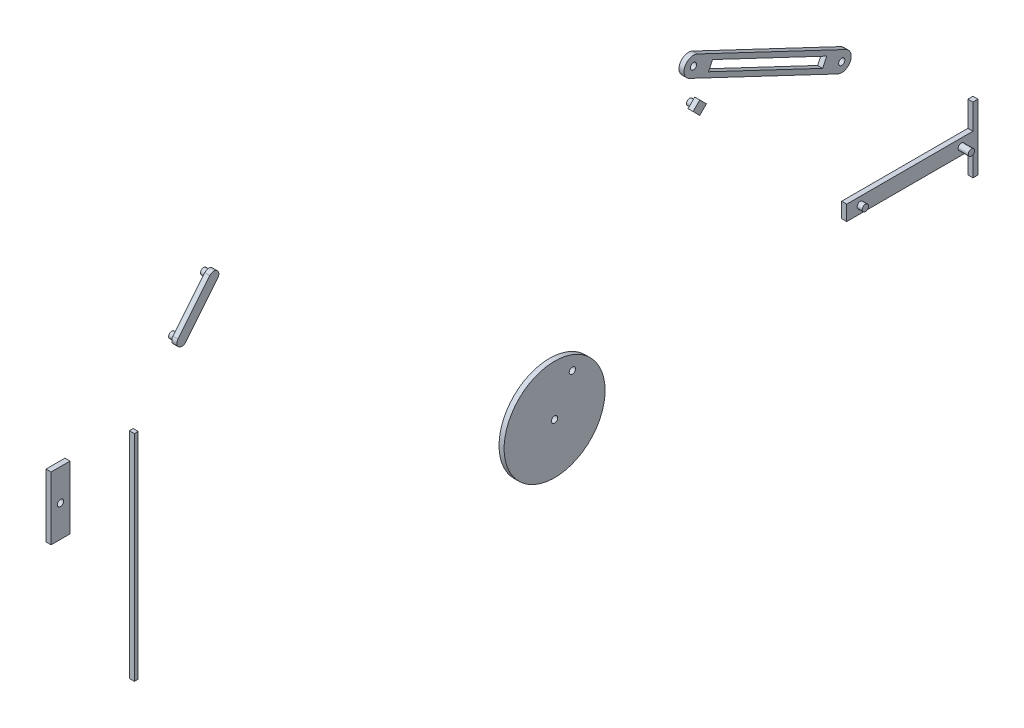
from build123d import *

# Parameters (mm, degrees)
SKETCH5_R            = 400
BOSS_EXTRUDE6_DEPTH  = 40
SKETCH6_R            = 25
CUT_EXTRUDE2_DEPTH   = 40
SKETCH8_R            = 25
BOSS_EXTRUDE7_DEPTH  = 40
BOSS_EXTRUDE8_START  = -40
SKETCH8_3_R          = 25
BOSS_EXTRUDE8_DEPTH  = 80
SKETCH9_R            = 25
CUT_EXTRUDE3_DEPTH   = 40
SKETCH9_4_R          = 25
BOSS_EXTRUDE9_DEPTH  = 40
BOSS_EXTRUDE10_START = 40
SKETCH9_5_R          = 25
BOSS_EXTRUDE10_DEPTH = 80
SKETCH10_R           = 25
BOSS_EXTRUDE11_DEPTH = 80
SKETCH12_R           = 25
BOSS_EXTRUDE12_DEPTH = 40
BOSS_EXTRUDE13_DEPTH = 40
SKETCH13_3_R         = 25
BOSS_EXTRUDE14_DEPTH = 40
SKETCH14_W           = 20
SKETCH14_H           = 2000
SKETCH14_W_2         = 150
SKETCH14_H_2         = 500
SKETCH14_R           = 25
BOSS_EXTRUDE15_DEPTH = 40
CUT_EXTRUDE4_DEPTH   = 369
BOSS_EXTRUDE16_DEPTH = 30
SCALE1_START         = -40
SCALE1_OUTLINE_R     = 60
SCALE1_OUTLINE_W     = 255
SCALE1_OUTLINE_H     = 4.5
SCALE1_OUTLINE_W_2   = 75
SCALE1_OUTLINE_H_2   = 22.5
SCALE1_OUTLINE_R_2   = 3.75
SCALE1_DEPTH         = 160
SCALE1_2_OUTLINE_R   = 60
SCALE1_2_OUTLINE_R_2 = 3.75
SCALE1_2_DEPTH       = 57
SCALE1_START_2       = 23
SCALE1_3_OUTLINE_R   = 60
SCALE1_3_OUTLINE_R_2 = 3.75
SCALE1_3_OUTLINE_W   = 255
SCALE1_3_OUTLINE_H   = 4.5
SCALE1_3_OUTLINE_W_2 = 75
SCALE1_3_OUTLINE_H_2 = 22.5
SCALE1_3_DEPTH       = 34
SCALE1_START_3       = 63
SCALE1_4_OUTLINE_W   = 255
SCALE1_4_OUTLINE_H   = 4.5
SCALE1_4_OUTLINE_W_2 = 75
SCALE1_4_OUTLINE_H_2 = 22.5
SCALE1_4_OUTLINE_R   = 3.75
SCALE1_4_DEPTH       = 57
SCALE1_START_4       = -15.179599902
SCALE1_5_OUTLINE_R   = 3.75
SCALE1_5_DEPTH       = 57.382224362
SCALE1_6_DEPTH       = 18.820400098
SCALE1_START_5       = 99.739776566
SCALE1_7_DEPTH       = 20.260223434
SCALE1_START_6       = 54.20262446
SCALE1_8_OUTLINE_R   = 3.75
SCALE1_8_DEPTH       = 39.537152106
SCALE1_START_7       = -9.179599902
SCALE1_9_OUTLINE_R   = 3.75
SCALE1_9_DEPTH       = 96.919376468
SCALE1_START_8       = -3.179599902
SCALE1_10_OUTLINE_R  = 3.75
SCALE1_10_DEPTH      = 51.382224362
SCALE1_START_9       = 57
SCALE1_11_OUTLINE_R  = 3.75
SCALE1_11_DEPTH      = 6


# Read off the part's stored shape, not the designer's step: Scale1
with BuildPart() as part:
    # Sketch5 → Boss-Extrude6 (new body)
    with BuildSketch(Plane(origin=(0, 0, 0), x_dir=(0, 0, -1), z_dir=(1, 0, 0))):
        Circle(SKETCH5_R)
    extrude(amount=BOSS_EXTRUDE6_DEPTH)

    # Sketch6 → Cut-Extrude2 (cut)
    with BuildSketch(Plane(origin=(40, 0, 0), x_dir=(0, 0, -1), z_dir=(1, 0, 0))):
        Circle(SKETCH6_R)
    extrude(amount=-CUT_EXTRUDE2_DEPTH, mode=Mode.SUBTRACT)

    # Sketch9 → Cut-Extrude3 (cut)
    with BuildSketch(Plane(origin=(40, 0, 0), x_dir=(0, 0, -1), z_dir=(1, 0, 0))):
        with Locations((140.808826922, 264.901631291)):
            Circle(SKETCH9_R)
    extrude(amount=-CUT_EXTRUDE3_DEPTH, mode=Mode.SUBTRACT)


with BuildPart() as body_2:
    # Sketch8 → Boss-Extrude7 (new body)
    with BuildSketch(Plane(origin=(0, 0, 0), x_dir=(0, 0, -1), z_dir=(1, 0, 0))):
        Polygon((-107.7, 60), (892.3, 60), (892.3, 260), (932.3, 260), (932.3, -260), (892.3, -260), (892.3, -60), (-107.7, -60), align=None)
        Circle(SKETCH8_R, mode=Mode.SUBTRACT)
    extrude(amount=-BOSS_EXTRUDE7_DEPTH)


with BuildPart() as body_3:
    # Sketch8<3> → Boss-Extrude8 (new body)
    with BuildSketch(Plane(origin=(0, 0, 0), x_dir=(0, 0, -1), z_dir=(1, 0, 0)).offset(BOSS_EXTRUDE8_START)):
        Circle(SKETCH8_3_R)
    extrude(amount=BOSS_EXTRUDE8_DEPTH)

    # Combine2: union body 2
    add(body_2.part)

    # Sketch10 → Boss-Extrude11 (add)
    with BuildSketch(Plane(origin=(0, 0, 0), x_dir=(0, 0, -1), z_dir=(1, 0, 0))):
        with Locations(Location((800, 0, 0), (0, 0, 180))):
            Circle(SKETCH10_R)
    extrude(amount=BOSS_EXTRUDE11_DEPTH)


with BuildPart() as body_3_2:
    # Sketch9<4> → Boss-Extrude9 (new body)
    with BuildSketch(Plane(origin=(40, 0, 0), x_dir=(0, 0, -1), z_dir=(1, 0, 0))):
        Polygon((193.84183535, 264.905761095), (140.812956726, 211.868622863), (87.775818494, 264.897501488), (140.804697119, 317.934639719), align=None)
        with Locations((140.808826922, 264.901631291)):
            Circle(SKETCH9_4_R, mode=Mode.SUBTRACT)
    extrude(amount=BOSS_EXTRUDE9_DEPTH)

    # Sketch9<5> → Boss-Extrude10 (add)
    with BuildSketch(Plane(origin=(40, 0, 0), x_dir=(0, 0, -1), z_dir=(1, 0, 0)).offset(BOSS_EXTRUDE10_START)):
        with Locations((140.808826922, 264.901631291)):
            Circle(SKETCH9_5_R)
    extrude(amount=-BOSS_EXTRUDE10_DEPTH)


with BuildPart() as body_4:
    # Sketch12 → Boss-Extrude12 (new body)
    with BuildSketch(Plane(origin=(80, 0, 0), x_dir=(0, 0, -1), z_dir=(1, 0, 0))):
        with BuildLine():
            Line((-342.623929428, 624.528266693), (832.120454935, 67.773714482))
            ThreePointArc((832.120454935, 67.773714482), (867.773714482, -32.120454935), (767.879545065, -67.773714482))
            Line((767.879545065, -67.773714482), (-406.864839299, 488.980837728))
            ThreePointArc((-406.864839299, 488.980837728), (-442.518098846, 588.875007145), (-342.623929428, 624.528266693))
        make_face()
        with Locations((-374.744384363, 556.75455221)):
            Circle(SKETCH12_R, mode=Mode.SUBTRACT)
        with Locations(Location((800, 0, 0), (0, 0, 180))):
            Circle(SKETCH12_R, mode=Mode.SUBTRACT)
        Polygon((648.392343567, 30.354052629), (-255.257182866, 458.626785099), (-223.136727931, 526.400499581), (680.512798503, 98.127767112), align=None, mode=Mode.SUBTRACT)
    extrude(amount=-BOSS_EXTRUDE12_DEPTH)


with BuildPart() as body_5:
    # Sketch13 → Boss-Extrude13 (new body)
    with BuildSketch(Plane(origin=(80, 0, 0), x_dir=(0, 0, -1), z_dir=(1, 0, 0))):
        with BuildLine():
            Line((-343.742373844, 531.478568673), (-596.502209216, 221.458463482))
            ThreePointArc((-596.502209216, 221.458463482), (-652.780203272, 215.7324365), (-658.506230254, 272.010430556))
            Line((-658.506230254, 272.010430556), (-405.746394882, 582.030535747))
            ThreePointArc((-405.746394882, 582.030535747), (-349.468400826, 587.756562729), (-343.742373844, 531.478568673))
        make_face()
    extrude(amount=BOSS_EXTRUDE13_DEPTH)

    # Sketch13<3> → Boss-Extrude14 (add)
    with BuildSketch(Plane(origin=(80, 0, 0), x_dir=(0, 0, -1), z_dir=(1, 0, 0))):
        with Locations((-374.744384363, 556.75455221)):
            Circle(SKETCH13_3_R)
        with Locations((-627.504219735, 246.734447019)):
            Circle(SKETCH13_3_R)
    extrude(amount=-BOSS_EXTRUDE14_DEPTH)


with BuildPart() as body_6:
    # Sketch14 → Boss-Extrude15 (new body)
    # profile 1 of 2: a face of its own
    with BuildSketch(Plane.ZY.offset(-80)):
        with Locations((542.504219735, -3.265552981)):
            Rectangle(SKETCH14_W, SKETCH14_H)
    # profile 2 of 2: a face of its own
    with BuildSketch(Plane.ZY.offset(-80)):
        with Locations((627.504219735, 246.734447019)):
            Rectangle(SKETCH14_W_2, SKETCH14_H_2)
        with Locations(Location((627.504219735, 246.734447019, 0), (0, 0, 180))):
            Circle(SKETCH14_R, mode=Mode.SUBTRACT)
    extrude(amount=BOSS_EXTRUDE15_DEPTH)

    # Sketch15 → Cut-Extrude4 (cut)
    with BuildSketch(Plane(origin=(80, 0, 0), x_dir=(0, 0, -1), z_dir=(1, 0, 0))):
        Polygon((-552.504219735, 496.734447019), (-552.504219735, -3.265552981), (-552.504219735, -1003.265552981), (-532.504219735, -1003.265552981), (-532.504219735, 996.734447019), (-552.504219735, 996.734447019), align=None)
    extrude(amount=-CUT_EXTRUDE4_DEPTH, mode=Mode.SUBTRACT)


with BuildPart() as body_7:
    # Sketch16 → Boss-Extrude16 (new body)
    with BuildSketch(Plane(origin=(0, 0, 552.504219735), x_dir=(-1, 0, 0), z_dir=(0, 0, -1))):
        Polygon((-80, 496.734447019), (-80, 996.734447019), (-40, 996.734447019), (-40, 496.734447019), (-40, -3.265552981), (-40, -703.265552981), (-80, -703.265552981), (-80, -3.265552981), align=None)
    extrude(amount=BOSS_EXTRUDE16_DEPTH)


with BuildPart() as scale1_tool:
    # Scale1 outline → Scale1 (new body)
    # profile 1 of 7: a face of its own
    with BuildSketch(Plane.YZ.offset(SCALE1_START)):
        with BuildLine():
            Line((-60, -395.474398666), (-60, -751.47711531))
            Line((-60, -751.47711531), (-67.773714482, -767.879545065))
            ThreePointArc((-67.773714482, -767.879545065), (-74.62185786, -807.521856784), (-60, -844.999999999))
            Line((-60, -844.999999999), (-60, -892.3))
            Line((-60, -892.3), (-260, -892.3))
            Line((-260, -892.3), (-260, -932.3))
            Line((-260, -932.3), (260, -932.3))
            Line((260, -932.3), (260, -892.3))
            Line((260, -892.3), (60, -892.3))
            Line((60, -892.3), (60, -844.999999999))
            ThreePointArc((60, -844.999999999), (64.210600358, -838.755629288), (67.773714482, -832.120454935))
            Line((67.773714482, -832.120454935), (624.528266693, 342.623929428))
            ThreePointArc((624.528266693, 342.623929428), (612.830437505, 424.548953315), (532.859108949, 445.83592951))
            Line((532.859108949, 445.83592951), (438.822367054, 522.504219735))
            Line((438.822367054, 522.504219735), (996.734447019, 522.504219735))
            Line((996.734447019, 522.504219735), (996.734447019, 552.504219735))
            Line((996.734447019, 552.504219735), (496.734447019, 552.504219735))
            Line((496.734447019, 552.504219735), (496.734447019, 702.504219735))
            Line((496.734447019, 702.504219735), (-3.265552981, 702.504219735))
            Line((-3.265552981, 702.504219735), (-3.265552981, 552.504219735))
            Line((-3.265552981, 552.504219735), (-703.265552981, 552.504219735))
            Line((-703.265552981, 552.504219735), (-703.265552981, 522.504219735))
            Line((-703.265552981, 522.504219735), (312.219974104, 522.504219735))
            Line((312.219974104, 522.504219735), (479.247092245, 386.326771314))
            Line((479.247092245, 386.326771314), (369.153644363, 154.031123003))
            ThreePointArc((369.153644363, 154.031123003), (-315.250810533, 246.205049619), (-60, -395.474398666))
        make_face()
        with BuildLine():
            Line((60, -498.278779411), (60, -395.474398666))
            ThreePointArc((60, -395.474398666), (87.469750454, -390.319154994), (114.512449681, -383.258266536))
            Line((114.512449681, -383.258266536), (60, -498.278779411))
        make_face(mode=Mode.SUBTRACT)
        Polygon((-9, -534.787278323), (-9, -384.787278323), (9, -384.787278323), (9, -534.787278323), (39, -534.787278323), (39, -540.787278323), (-39, -540.787278323), (-39, -534.787278323), align=None, mode=Mode.SUBTRACT)
        with Locations((-0.886481837, 0.471210641)):
            Circle(SCALE1_OUTLINE_R, mode=Mode.SUBTRACT)
        with BuildLine():
            Line((60, -585.83980573), (164.944620313, -364.40811219))
            ThreePointArc((164.944620313, -364.40811219), (231.868078939, -325.940476114), (290.156613301, -275.334596006))
            Line((290.156613301, -275.334596006), (98.127767112, -680.512798503))
            Line((98.127767112, -680.512798503), (60, -662.442647934))
            Line((60, -662.442647934), (60, -585.83980573))
        make_face(mode=Mode.SUBTRACT)
        with BuildLine():
            Line((526.400499581, 223.136727931), (396.83062419, -50.253912332))
            ThreePointArc((396.83062419, -50.253912332), (399.094174855, 26.90426726), (386.495188213, 103.060513722))
            Line((386.495188213, 103.060513722), (458.626785099, 255.257182866))
            Line((458.626785099, 255.257182866), (526.400499581, 223.136727931))
        make_face(mode=Mode.SUBTRACT)
        with BuildLine():
            Line((226.454627517, -295.915568405), (309.967810349, -119.703910751))
            ThreePointArc((309.967810349, -119.703910751), (324.951935761, -114.355921819), (330.299924693, -129.340047231))
            Line((330.299924693, -129.340047231), (246.786741862, -305.551704886))
            ThreePointArc((246.786741862, -305.551704886), (231.802616449, -310.899693818), (226.454627517, -295.915568405))
        make_face(mode=Mode.SUBTRACT)
        with BuildLine():
            ThreePointArc((374.701594195, 515.430988124), (373.842690147, 523.872687233), (382.284389256, 524.73159128))
            Line((382.284389256, 524.73159128), (428.787405034, 486.817615974))
            ThreePointArc((428.787405034, 486.817615974), (429.646309082, 478.375916865), (421.204609973, 477.517012818))
            Line((421.204609973, 477.517012818), (374.701594195, 515.430988124))
        make_face(mode=Mode.SUBTRACT)
        Polygon((264.901011821, -132.853875658), (272.856582556, -140.808207452), (264.902250762, -148.763778186), (256.946680027, -140.809446393), align=None, mode=Mode.SUBTRACT)
        with Locations((146.734447019, 537.504219735)):
            Rectangle(SCALE1_OUTLINE_W, SCALE1_OUTLINE_H, mode=Mode.SUBTRACT)
        with Locations((246.734447019, 627.504219735)):
            Rectangle(SCALE1_OUTLINE_W_2, SCALE1_OUTLINE_H_2, mode=Mode.SUBTRACT)
    # profile 2 of 7: a face of its own
    with BuildSketch(Plane.YZ.offset(SCALE1_START)):
        Polygon((315.580759627, -147.263127456), (305.414702454, -142.445059216), (241.173792584, -277.992488181), (251.339849756, -282.810556421), align=None)
    # profile 3 of 7: a face of its own
    with BuildSketch(Plane.YZ.offset(SCALE1_START)):
        with Locations((-0.886481837, 0.471210641)):
            Circle(SCALE1_OUTLINE_R_2)
    # profile 4 of 7: a face of its own
    with BuildSketch(Plane.YZ.offset(SCALE1_START)):
        with Locations((38.848762857, -20.650113397)):
            Circle(SCALE1_OUTLINE_R_2)
    # profile 5 of 7: a face of its own
    with BuildSketch(Plane.YZ.offset(SCALE1_START)):
        with Locations((320.133867521, -124.521978991)):
            Circle(SCALE1_OUTLINE_R_2)
    # profile 6 of 7: a face of its own
    with BuildSketch(Plane.YZ.offset(SCALE1_START)):
        with Locations((236.620684689, -300.733636646)):
            Circle(SCALE1_OUTLINE_R_2)
    # profile 7 of 7: a face of its own
    with BuildSketch(Plane.YZ.offset(SCALE1_START)):
        with Locations((246.734447019, 627.504219735)):
            Circle(SCALE1_OUTLINE_R_2)
    extrude(amount=SCALE1_DEPTH)


with BuildPart() as part_1:
    add(part.part)

    # Scale1: cut by scale1_tool
    add(scale1_tool.part, mode=Mode.SUBTRACT)


with BuildPart() as body_3_1:
    add(body_3.part)

    # Scale1: cut by scale1_tool
    add(scale1_tool.part, mode=Mode.SUBTRACT)


with BuildPart() as body_3_2_1:
    add(body_3_2.part)

    # Scale1: cut by scale1_tool
    add(scale1_tool.part, mode=Mode.SUBTRACT)


with BuildPart() as body_4_1:
    add(body_4.part)

    # Scale1: cut by scale1_tool
    add(scale1_tool.part, mode=Mode.SUBTRACT)


with BuildPart() as body_5_1:
    add(body_5.part)

    # Scale1: cut by scale1_tool
    add(scale1_tool.part, mode=Mode.SUBTRACT)


with BuildPart() as body_6_1:
    add(body_6.part)

    # Scale1: cut by scale1_tool
    add(scale1_tool.part, mode=Mode.SUBTRACT)


with BuildPart() as body_7_1:
    add(body_7.part)

    # Scale1: cut by scale1_tool
    add(scale1_tool.part, mode=Mode.SUBTRACT)


with BuildPart() as scale1_2_tool:
    # Scale1 2 outline → Scale1 2 (new body)
    # profile 1 of 3: a face of its own
    with BuildSketch(Plane.YZ.offset(SCALE1_START)):
        with Locations((-0.886481837, 0.471210641)):
            Circle(SCALE1_2_OUTLINE_R)
        with Locations((38.848762857, -20.650113397)):
            Circle(SCALE1_2_OUTLINE_R_2, mode=Mode.SUBTRACT)
        with Locations((-0.886481837, 0.471210641)):
            Circle(SCALE1_2_OUTLINE_R_2, mode=Mode.SUBTRACT)
    # profile 2 of 3: a face of its own
    with BuildSketch(Plane.YZ.offset(SCALE1_START)):
        with BuildLine():
            ThreePointArc((226.454627517, -295.915568405), (231.802616449, -310.899693818), (246.786741862, -305.551704886))
            Line((246.786741862, -305.551704886), (330.299924693, -129.340047231))
            ThreePointArc((330.299924693, -129.340047231), (324.951935761, -114.355921819), (309.967810349, -119.703910751))
            Line((309.967810349, -119.703910751), (226.454627517, -295.915568405))
        make_face()
        Polygon((305.414702454, -142.445059216), (315.580759627, -147.263127456), (251.339849756, -282.810556421), (241.173792584, -277.992488181), align=None, mode=Mode.SUBTRACT)
        with Locations((320.133867521, -124.521978991)):
            Circle(SCALE1_2_OUTLINE_R_2, mode=Mode.SUBTRACT)
        with Locations((236.620684689, -300.733636646)):
            Circle(SCALE1_2_OUTLINE_R_2, mode=Mode.SUBTRACT)
    # profile 3 of 3: a face of its own
    with BuildSketch(Plane.YZ.offset(SCALE1_START)):
        Polygon((272.856582556, -140.808207452), (264.901011821, -132.853875658), (256.946680027, -140.809446393), (264.902250762, -148.763778186), align=None)
    extrude(amount=SCALE1_2_DEPTH)


with BuildPart() as part_2:
    add(part_1.part)

    # Scale1 2: cut by scale1_2_tool
    add(scale1_2_tool.part, mode=Mode.SUBTRACT)


with BuildPart() as body_3_3:
    add(body_3_1.part)

    # Scale1 2: cut by scale1_2_tool
    add(scale1_2_tool.part, mode=Mode.SUBTRACT)


with BuildPart() as body_3_2_2:
    add(body_3_2_1.part)

    # Scale1 2: cut by scale1_2_tool
    add(scale1_2_tool.part, mode=Mode.SUBTRACT)


with BuildPart() as scale1_3_tool:
    # Scale1 3 outline → Scale1 3 (new body)
    # profile 1 of 6: a face of its own
    with BuildSketch(Plane.YZ.offset(SCALE1_START_2)):
        with BuildLine():
            Line((9, -399.898737182), (9, -384.787278323))
            Line((9, -384.787278323), (-9, -384.787278323))
            Line((-9, -384.787278323), (-9, -399.898737182))
            ThreePointArc((-9, -399.898737182), (0, -400), (9, -399.898737182))
        make_face()
    # profile 2 of 6: a face of its own
    with BuildSketch(Plane.YZ.offset(SCALE1_START_2)):
        with Locations((-0.886481837, 0.471210641)):
            Circle(SCALE1_3_OUTLINE_R)
        with Locations((38.848762857, -20.650113397)):
            Circle(SCALE1_3_OUTLINE_R_2, mode=Mode.SUBTRACT)
        with Locations((-0.886481837, 0.471210641)):
            Circle(SCALE1_3_OUTLINE_R_2, mode=Mode.SUBTRACT)
    # profile 3 of 6: a face of its own
    with BuildSketch(Plane.YZ.offset(SCALE1_START_2)):
        with BuildLine():
            ThreePointArc((226.454627517, -295.915568405), (231.802616449, -310.899693818), (246.786741862, -305.551704886))
            Line((246.786741862, -305.551704886), (330.299924693, -129.340047231))
            ThreePointArc((330.299924693, -129.340047231), (324.951935761, -114.355921819), (309.967810349, -119.703910751))
            Line((309.967810349, -119.703910751), (226.454627517, -295.915568405))
        make_face()
        Polygon((305.414702454, -142.445059216), (315.580759627, -147.263127456), (251.339849756, -282.810556421), (241.173792584, -277.992488181), align=None, mode=Mode.SUBTRACT)
        with Locations((320.133867521, -124.521978991)):
            Circle(SCALE1_3_OUTLINE_R_2, mode=Mode.SUBTRACT)
        with Locations((236.620684689, -300.733636646)):
            Circle(SCALE1_3_OUTLINE_R_2, mode=Mode.SUBTRACT)
    # profile 4 of 6: a face of its own
    with BuildSketch(Plane.YZ.offset(SCALE1_START_2)):
        with BuildLine():
            ThreePointArc((382.284389256, 524.73159128), (377.092712508, 525.915603554), (373.003965394, 522.504219735))
            Line((373.003965394, 522.504219735), (385.016350051, 522.504219735))
            Line((385.016350051, 522.504219735), (382.284389256, 524.73159128))
        make_face()
    # profile 5 of 6: a face of its own
    with BuildSketch(Plane.YZ.offset(SCALE1_START_2)):
        with Locations((146.734447019, 537.504219735)):
            Rectangle(SCALE1_3_OUTLINE_W, SCALE1_3_OUTLINE_H)
    # profile 6 of 6: a face of its own
    with BuildSketch(Plane.YZ.offset(SCALE1_START_2)):
        with Locations((246.734447019, 627.504219735)):
            Rectangle(SCALE1_3_OUTLINE_W_2, SCALE1_3_OUTLINE_H_2)
        with Locations((246.734447019, 627.504219735)):
            Circle(SCALE1_3_OUTLINE_R_2, mode=Mode.SUBTRACT)
    extrude(amount=SCALE1_3_DEPTH)


with BuildPart() as part_3:
    add(part_2.part)

    # Scale1 3: cut by scale1_3_tool
    add(scale1_3_tool.part, mode=Mode.SUBTRACT)


with BuildPart() as body_3_4:
    add(body_3_3.part)

    # Scale1 3: cut by scale1_3_tool
    add(scale1_3_tool.part, mode=Mode.SUBTRACT)


with BuildPart() as body_3_2_3:
    add(body_3_2_2.part)

    # Scale1 3: cut by scale1_3_tool
    add(scale1_3_tool.part, mode=Mode.SUBTRACT)


with BuildPart() as body_5_2:
    add(body_5_1.part)

    # Scale1 3: cut by scale1_3_tool
    add(scale1_3_tool.part, mode=Mode.SUBTRACT)


with BuildPart() as body_6_2:
    add(body_6_1.part)

    # Scale1 3: cut by scale1_3_tool
    add(scale1_3_tool.part, mode=Mode.SUBTRACT)


with BuildPart() as body_7_2:
    add(body_7_1.part)

    # Scale1 3: cut by scale1_3_tool
    add(scale1_3_tool.part, mode=Mode.SUBTRACT)


with BuildPart() as scale1_4_tool:
    # Scale1 4 outline → Scale1 4 (new body)
    # profile 1 of 4: a face of its own
    with BuildSketch(Plane.YZ.offset(SCALE1_START_3)):
        Polygon((317.934639719, -140.804697119), (305.744043776, -128.615999648), (283.77564868, -174.969008652), (295.61002827, -163.132785777), (305.414702454, -142.445059216), (312.796549305, -145.943587825), align=None)
    # profile 2 of 4: a face of its own
    with BuildSketch(Plane.YZ.offset(SCALE1_START_3)):
        Polygon((272.856582556, -140.808207452), (264.901011821, -132.853875658), (256.946680027, -140.809446393), (264.902250762, -148.763778186), align=None)
    # profile 3 of 4: a face of its own
    with BuildSketch(Plane.YZ.offset(SCALE1_START_3)):
        with Locations((146.734447019, 537.504219735)):
            Rectangle(SCALE1_4_OUTLINE_W, SCALE1_4_OUTLINE_H)
    # profile 4 of 4: a face of its own
    with BuildSketch(Plane.YZ.offset(SCALE1_START_3)):
        with Locations((246.734447019, 627.504219735)):
            Rectangle(SCALE1_4_OUTLINE_W_2, SCALE1_4_OUTLINE_H_2)
        with Locations((246.734447019, 627.504219735)):
            Circle(SCALE1_4_OUTLINE_R, mode=Mode.SUBTRACT)
    extrude(amount=SCALE1_4_DEPTH)


with BuildPart() as body_3_2_4:
    add(body_3_2_3.part)

    # Scale1 4: cut by scale1_4_tool
    add(scale1_4_tool.part, mode=Mode.SUBTRACT)


with BuildPart() as body_4_2:
    add(body_4_1.part)

    # Scale1 4: cut by scale1_4_tool
    add(scale1_4_tool.part, mode=Mode.SUBTRACT)


with BuildPart() as body_5_3:
    add(body_5_2.part)

    # Scale1 4: cut by scale1_4_tool
    add(scale1_4_tool.part, mode=Mode.SUBTRACT)

    # Scale1 7 outline → Scale1 7 (cut)
    with BuildSketch(Plane.YZ.offset(SCALE1_START_5)):
        with BuildLine():
            Line((428.787405034, 486.817615974), (382.284389256, 524.73159128))
            ThreePointArc((382.284389256, 524.73159128), (373.842690147, 523.872687233), (374.701594195, 515.430988124))
            Line((374.701594195, 515.430988124), (421.204609973, 477.517012818))
            ThreePointArc((421.204609973, 477.517012818), (429.646309082, 478.375916865), (428.787405034, 486.817615974))
        make_face()
    extrude(amount=SCALE1_7_DEPTH, mode=Mode.SUBTRACT)


with BuildPart() as body_6_3:
    add(body_6_2.part)

    # Scale1 4: cut by scale1_4_tool
    add(scale1_4_tool.part, mode=Mode.SUBTRACT)



with BuildPart() as body_7_3:
    add(body_7_2.part)

    # Scale1 4: cut by scale1_4_tool
    add(scale1_4_tool.part, mode=Mode.SUBTRACT)


with BuildPart() as scale1_5_tool:
    # Scale1 5 outline → Scale1 5 (new body)
    # profile 1 of 3: a face of its own
    with BuildSketch(Plane.YZ.offset(SCALE1_START_4)):
        Polygon((9, -534.787278323), (9, -384.787278323), (-9, -384.787278323), (-9, -534.787278323), (-39, -534.787278323), (-39, -540.787278323), (39, -540.787278323), (39, -534.787278323), align=None)
        with Locations((0, -400.942278323)):
            Circle(SCALE1_5_OUTLINE_R, mode=Mode.SUBTRACT)
        with Locations((0, -520.942278323)):
            Circle(SCALE1_5_OUTLINE_R, mode=Mode.SUBTRACT)
    # profile 2 of 3: a face of its own
    with BuildSketch(Plane.YZ.offset(SCALE1_START_4)):
        with BuildLine():
            ThreePointArc((226.454627517, -295.915568405), (231.802616449, -310.899693818), (246.786741862, -305.551704886))
            Line((246.786741862, -305.551704886), (330.299924693, -129.340047231))
            ThreePointArc((330.299924693, -129.340047231), (324.951935761, -114.355921819), (309.967810349, -119.703910751))
            Line((309.967810349, -119.703910751), (226.454627517, -295.915568405))
        make_face()
        Polygon((305.414702454, -142.445059216), (315.580759627, -147.263127456), (251.339849756, -282.810556421), (241.173792584, -277.992488181), align=None, mode=Mode.SUBTRACT)
        with Locations((320.133867521, -124.521978991)):
            Circle(SCALE1_5_OUTLINE_R, mode=Mode.SUBTRACT)
        with Locations((236.620684689, -300.733636646)):
            Circle(SCALE1_5_OUTLINE_R, mode=Mode.SUBTRACT)
    # profile 3 of 3: a face of its own
    with BuildSketch(Plane.YZ.offset(SCALE1_START_4)):
        Polygon((272.856582556, -140.808207452), (264.901011821, -132.853875658), (256.946680027, -140.809446393), (264.902250762, -148.763778186), align=None)
    extrude(amount=SCALE1_5_DEPTH)


with BuildPart() as part_4:
    add(part_3.part)

    # Scale1 5: cut by scale1_5_tool
    add(scale1_5_tool.part, mode=Mode.SUBTRACT)


with BuildPart() as body_3_5:
    add(body_3_4.part)

    # Scale1 5: cut by scale1_5_tool
    add(scale1_5_tool.part, mode=Mode.SUBTRACT)

    # Scale1 6 outline → Scale1 6 (cut)
    with BuildSketch(Plane.YZ.offset(SCALE1_START)):
        Polygon((9, -534.787278323), (9, -384.787278323), (-9, -384.787278323), (-9, -534.787278323), (-39, -534.787278323), (-39, -540.787278323), (39, -540.787278323), (39, -534.787278323), align=None)
    extrude(amount=SCALE1_6_DEPTH, mode=Mode.SUBTRACT)


with BuildPart() as body_3_2_5:
    add(body_3_2_4.part)

    # Scale1 5: cut by scale1_5_tool
    add(scale1_5_tool.part, mode=Mode.SUBTRACT)


with BuildPart() as body_4_3:
    add(body_4_2.part)

    # Scale1 5: cut by scale1_5_tool
    add(scale1_5_tool.part, mode=Mode.SUBTRACT)


with BuildPart() as scale1_8_tool:
    # Scale1 8 outline → Scale1 8 (new body)
    # profile 1 of 2: a face of its own
    with BuildSketch(Plane.YZ.offset(SCALE1_START_6)):
        with BuildLine():
            Line((428.787405034, 486.817615974), (382.284389256, 524.73159128))
            ThreePointArc((382.284389256, 524.73159128), (373.842690147, 523.872687233), (374.701594195, 515.430988124))
            Line((374.701594195, 515.430988124), (421.204609973, 477.517012818))
            ThreePointArc((421.204609973, 477.517012818), (429.646309082, 478.375916865), (428.787405034, 486.817615974))
        make_face()
        with Locations((378.492991725, 520.081289702)):
            Circle(SCALE1_8_OUTLINE_R, mode=Mode.SUBTRACT)
        with Locations((424.996007504, 482.167314396)):
            Circle(SCALE1_8_OUTLINE_R, mode=Mode.SUBTRACT)
    # profile 2 of 2: a face of its own
    with BuildSketch(Plane.YZ.offset(SCALE1_START_6)):
        Polygon((272.856582556, -140.808207452), (264.901011821, -132.853875658), (256.946680027, -140.809446393), (264.902250762, -148.763778186), align=None)
    extrude(amount=SCALE1_8_DEPTH)


with BuildPart() as body_3_2_6:
    add(body_3_2_5.part)

    # Scale1 8: cut by scale1_8_tool
    add(scale1_8_tool.part, mode=Mode.SUBTRACT)


with BuildPart() as body_4_4:
    add(body_4_3.part)

    # Scale1 8: cut by scale1_8_tool
    add(scale1_8_tool.part, mode=Mode.SUBTRACT)


with BuildPart() as body_5_4:
    add(body_5_3.part)

    # Scale1 8: cut by scale1_8_tool
    add(scale1_8_tool.part, mode=Mode.SUBTRACT)


with BuildPart() as body_7_4:
    add(body_7_3.part)

    # Scale1 8: cut by scale1_8_tool
    add(scale1_8_tool.part, mode=Mode.SUBTRACT)


with BuildPart() as scale1_9_tool:
    # Scale1 9 outline → Scale1 9 (new body)
    with BuildSketch(Plane.YZ.offset(SCALE1_START_7)):
        with Locations((0, -400.942278323)):
            Circle(SCALE1_9_OUTLINE_R)
        with Locations((378.492991725, 520.081289702)):
            Circle(SCALE1_9_OUTLINE_R)
        with Locations((424.996007504, 482.167314396)):
            Circle(SCALE1_9_OUTLINE_R)
    extrude(amount=SCALE1_9_DEPTH)


with BuildPart() as part_5:
    add(part_4.part)

    # Scale1 9: cut by scale1_9_tool
    add(scale1_9_tool.part, mode=Mode.SUBTRACT)


with BuildPart() as body_3_6:
    add(body_3_5.part)

    # Scale1 9: cut by scale1_9_tool
    add(scale1_9_tool.part, mode=Mode.SUBTRACT)


with BuildPart() as body_5_5:
    add(body_5_4.part)

    # Scale1 9: cut by scale1_9_tool
    add(scale1_9_tool.part, mode=Mode.SUBTRACT)


with BuildPart() as body_7_5:
    add(body_7_4.part)

    # Scale1 9: cut by scale1_9_tool
    add(scale1_9_tool.part, mode=Mode.SUBTRACT)


with BuildPart() as scale1_10_tool:
    # Scale1 10 outline → Scale1 10 (new body)
    # profile 1 of 2: a face of its own
    with BuildSketch(Plane.YZ.offset(SCALE1_START_8)):
        Polygon((272.856582556, -140.808207452), (264.901011821, -132.853875658), (256.946680027, -140.809446393), (264.902250762, -148.763778186), align=None)
        with Locations((264.901631291, -140.808826922)):
            Circle(SCALE1_10_OUTLINE_R, mode=Mode.SUBTRACT)
    # profile 2 of 2: a face of its own
    with BuildSketch(Plane.YZ.offset(SCALE1_START_8)):
        with Locations((0, -520.942278323)):
            Circle(SCALE1_10_OUTLINE_R)
    extrude(amount=SCALE1_10_DEPTH)


with BuildPart() as body_3_7:
    add(body_3_6.part)

    # Scale1 10: cut by scale1_10_tool
    add(scale1_10_tool.part, mode=Mode.SUBTRACT)


with BuildPart() as body_3_2_7:
    add(body_3_2_6.part)

    # Scale1 10: cut by scale1_10_tool
    add(scale1_10_tool.part, mode=Mode.SUBTRACT)


with BuildPart() as body_4_5:
    add(body_4_4.part)

    # Scale1 10: cut by scale1_10_tool
    add(scale1_10_tool.part, mode=Mode.SUBTRACT)


with BuildPart() as body_6_4:
    add(body_6_3.part)

    add(body_5_5.part)  # Scale1 11 merges body 5

    add(body_7_5.part)  # Scale1 11 merges body 7

    add(body_4_5.part)  # Scale1 11 merges body 4

    add(part_5.part)  # Scale1 11 merges part

    add(body_3_2_7.part)  # Scale1 11 merges body 3 2

    add(body_3_7.part)  # Scale1 11 merges body 3
    # Scale1 11 outline → Scale1 11 (add)
    with BuildSketch(Plane.YZ.offset(SCALE1_START_9)):
        with BuildLine():
            Line((309.967810349, -119.703910751), (305.744043776, -128.615999648))
            Line((305.744043776, -128.615999648), (317.934639719, -140.804697119))
            Line((317.934639719, -140.804697119), (312.796549305, -145.943587825))
            Line((312.796549305, -145.943587825), (315.580759627, -147.263127456))
            Line((315.580759627, -147.263127456), (251.339849756, -282.810556421))
            Line((251.339849756, -282.810556421), (241.173792584, -277.992488181))
            Line((241.173792584, -277.992488181), (295.61002827, -163.132785777))
            Line((295.61002827, -163.132785777), (283.77564868, -174.969008652))
            Line((283.77564868, -174.969008652), (226.454627517, -295.915568405))
            ThreePointArc((226.454627517, -295.915568405), (231.802616449, -310.899693818), (246.786741862, -305.551704886))
            Line((246.786741862, -305.551704886), (330.299924693, -129.340047231))
            ThreePointArc((330.299924693, -129.340047231), (324.951935761, -114.355921819), (309.967810349, -119.703910751))
        make_face()
        with Locations((236.620684689, -300.733636646)):
            Circle(SCALE1_11_OUTLINE_R, mode=Mode.SUBTRACT)
        with Locations((320.133867521, -124.521978991)):
            Circle(SCALE1_11_OUTLINE_R, mode=Mode.SUBTRACT)
    extrude(amount=SCALE1_11_DEPTH)


solid = body_6_4.part
